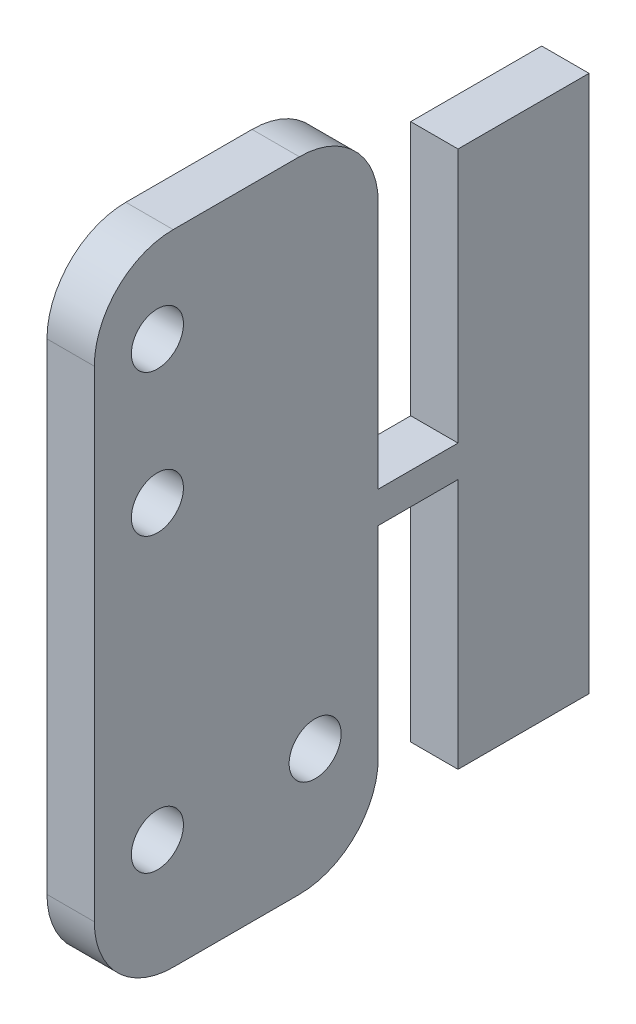
from build123d import *

# Parameters (mm, degrees)
T_LE_DE_BASE_PLI_E1_DEPTH    = 18
ENL_V_MAT_EXTRU_1_DEPTH      = 36.185224172
ENL_V_MAT_EXTRU_1_DEPTH_BACK = 36.185224172
ESQUISSE6_R                  = 1.65
ENL_V_MAT_EXTRU_2_DEPTH      = 35.756294394
ENL_V_MAT_EXTRU_2_DEPTH_BACK = 35.756294394
ESQUISSE7_R                  = 1.65
CONG_1_R                     = 5
BOSS_EXTRU_1_OUTLINE_R       = 1.65
BOSS_EXTRU_1_DEPTH           = 17
BOSS_EXTRU_1_START           = -3
BOSS_EXTRU_1_2_OUTLINE_R     = 1.65
BOSS_EXTRU_1_2_DEPTH         = 3


with BuildPart() as part:
    # Tôle de base pliée1: sheet metal written as solids
    # Esquisse1 → Tôle de base pliée1 (new body)
    with BuildSketch(Plane.XY):
        with BuildLine():
            Line((20, 0), (5, 0))
            ThreePointArc((5, 0), (1.464466094, 1.464466094), (0, 5))
            Line((0, 5), (0, 25))
            Line((0, 25), (3, 25))
            Line((3, 25), (3, 5))
            ThreePointArc((3, 5), (3.585786438, 3.585786438), (5, 3))
            Line((5, 3), (20, 3))
            Line((20, 3), (20, 0))
        make_face()
    extrude(amount=T_LE_DE_BASE_PLI_E1_DEPTH)

    # Esquisse6 → Enlèv. mat.-Extru.1 (cut, two sides: drawn at the far end of the back side and taken through both)
    with BuildSketch(Plane(origin=(3, 0, 0), x_dir=(0, 0, -1), z_dir=(1, 0, 0)).offset(-ENL_V_MAT_EXTRU_1_DEPTH_BACK)):
        with Locations((-14, 19.5)):
            Circle(ESQUISSE6_R)
        with Locations(Location((-14, 10.5, 0), (0, 0, 180))):
            Circle(ESQUISSE6_R)
    extrude(amount=ENL_V_MAT_EXTRU_1_DEPTH + ENL_V_MAT_EXTRU_1_DEPTH_BACK, mode=Mode.SUBTRACT)

    # Esquisse7 → Enlèv. mat.-Extru.2 (cut, two sides: drawn at the far end of the back side and taken through both)
    with BuildSketch(Plane(origin=(0, 3, 0), x_dir=(1, 0, 0), z_dir=(0, 1, 0)).offset(-ENL_V_MAT_EXTRU_2_DEPTH_BACK)):
        with Locations(Location((12.5, -4, 0), (0, 0, 270))):
            Circle(ESQUISSE7_R)
        with Locations(Location((12.5, -14, 0), (0, 0, 90))):
            Circle(ESQUISSE7_R)
    extrude(amount=ENL_V_MAT_EXTRU_2_DEPTH + ENL_V_MAT_EXTRU_2_DEPTH_BACK, mode=Mode.SUBTRACT)

    # Congé1
    cong_1_edges = [part.edges().sort_by_distance(p)[0] for p in [
        (20, 1.5, 18),
        (1.5, 25, 18),
        (20, 1.5, 0),
        (1.5, 25, 0),
    ]]
    fillet(cong_1_edges, radius=CONG_1_R)

    # Boss.-Extru.1: read off the stored shape, not the designer's step
    # Boss.-Extru.1 outline → Boss.-Extru.1 (cut)
    with BuildSketch(Plane(origin=(3, 0, 0), x_dir=(0, 0, -1), z_dir=(1, 0, 0))):
        with BuildLine():
            Line((-13, -15.497787144), (-5, -15.497787144))
            ThreePointArc((-5, -15.497787144), (-1.464466094, -14.03332105), (0, -10.497787144))
            Line((0, -10.497787144), (0, 2.251106428))
            Line((0, 2.251106428), (5.057824139, 2.251106428))
            Line((5.057824139, 2.251106428), (5.057824139, -13.661822952))
            Line((5.057824139, -13.661822952), (13.362072183, -13.661822952))
            Line((13.362072183, -13.661822952), (13.362072183, 20.398028744))
            Line((13.362072183, 20.398028744), (5.057824139, 20.398028744))
            Line((5.057824139, 20.398028744), (5.057824139, 4.251106428))
            Line((5.057824139, 4.251106428), (0, 4.251106428))
            Line((0, 4.251106428), (0, 20))
            ThreePointArc((0, 20), (-1.464466094, 23.535533906), (-5, 25))
            Line((-5, 25), (-13, 25))
            ThreePointArc((-13, 25), (-16.535533906, 23.535533906), (-18, 20))
            Line((-18, 20), (-18, -10.497787144))
            ThreePointArc((-18, -10.497787144), (-16.535533906, -14.03332105), (-13, -15.497787144))
        make_face()
        with Locations((-14, -7.997787144)):
            Circle(BOSS_EXTRU_1_OUTLINE_R, mode=Mode.SUBTRACT)
        with Locations((-4, -7.997787144)):
            Circle(BOSS_EXTRU_1_OUTLINE_R, mode=Mode.SUBTRACT)
        with Locations((-14, 10.5)):
            Circle(BOSS_EXTRU_1_OUTLINE_R, mode=Mode.SUBTRACT)
        with Locations((-14, 19.5)):
            Circle(BOSS_EXTRU_1_OUTLINE_R, mode=Mode.SUBTRACT)
    extrude(amount=BOSS_EXTRU_1_DEPTH, mode=Mode.SUBTRACT)

    # Boss.-Extru.1 2 outline → Boss.-Extru.1 2 (add)
    with BuildSketch(Plane(origin=(3, 0, 0), x_dir=(0, 0, -1), z_dir=(1, 0, 0)).offset(BOSS_EXTRU_1_START)):
        with BuildLine():
            Line((-13, -15.497787144), (-5, -15.497787144))
            ThreePointArc((-5, -15.497787144), (-1.464466094, -14.03332105), (0, -10.497787144))
            Line((0, -10.497787144), (0, 2.251106428))
            Line((0, 2.251106428), (5.057824139, 2.251106428))
            Line((5.057824139, 2.251106428), (5.057824139, -13.661822952))
            Line((5.057824139, -13.661822952), (13.362072183, -13.661822952))
            Line((13.362072183, -13.661822952), (13.362072183, 20.398028744))
            Line((13.362072183, 20.398028744), (5.057824139, 20.398028744))
            Line((5.057824139, 20.398028744), (5.057824139, 4.251106428))
            Line((5.057824139, 4.251106428), (0, 4.251106428))
            Line((0, 4.251106428), (0, 20))
            ThreePointArc((0, 20), (-1.464466094, 23.535533906), (-5, 25))
            Line((-5, 25), (-13, 25))
            ThreePointArc((-13, 25), (-16.535533906, 23.535533906), (-18, 20))
            Line((-18, 20), (-18, -10.497787144))
            ThreePointArc((-18, -10.497787144), (-16.535533906, -14.03332105), (-13, -15.497787144))
        make_face()
        with Locations((-14, -7.997787144)):
            Circle(BOSS_EXTRU_1_2_OUTLINE_R, mode=Mode.SUBTRACT)
        with Locations((-4, -7.997787144)):
            Circle(BOSS_EXTRU_1_2_OUTLINE_R, mode=Mode.SUBTRACT)
        with Locations((-14, 10.5)):
            Circle(BOSS_EXTRU_1_2_OUTLINE_R, mode=Mode.SUBTRACT)
        with Locations((-14, 19.5)):
            Circle(BOSS_EXTRU_1_2_OUTLINE_R, mode=Mode.SUBTRACT)
    extrude(amount=BOSS_EXTRU_1_2_DEPTH)


solid = part.part
